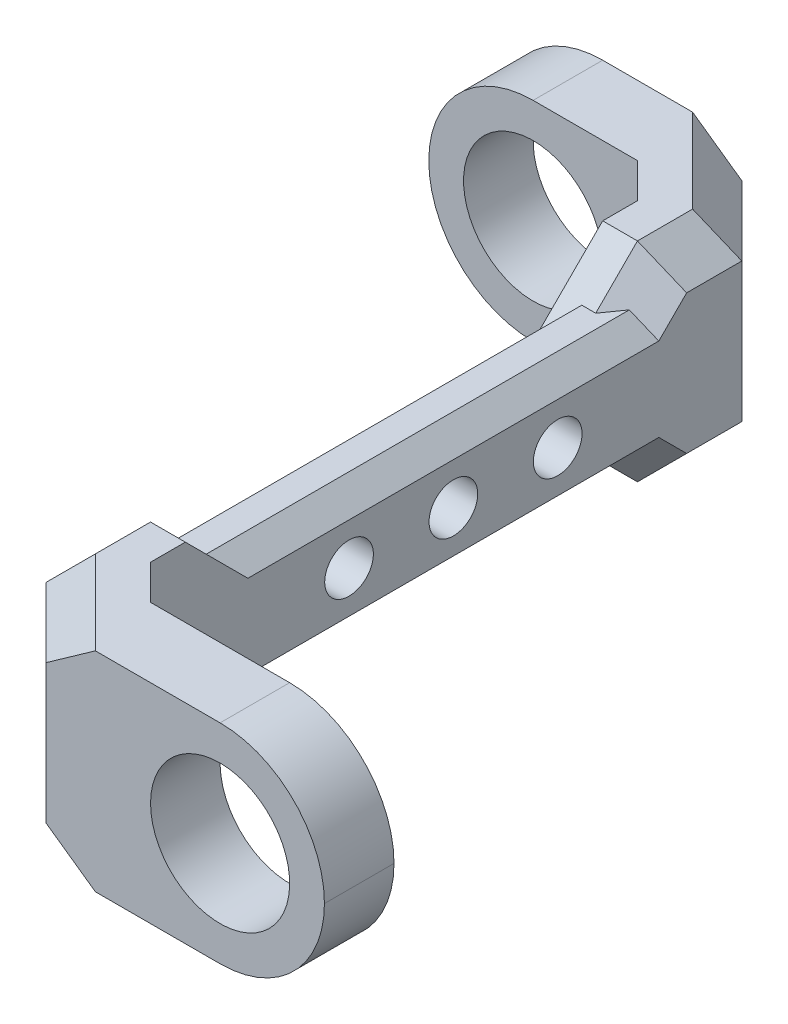
from build123d import *

# Parameters (mm, degrees)
SKETCH1_R           = 7.5
SKETCH1_R_2         = 5
BOSS_EXTRUDE1_DEPTH = 5
SKETCH2_W           = 5
SKETCH2_H           = 15
BOSS_EXTRUDE2_DEPTH = 50
SKETCH3_W           = 5
SKETCH3_H           = 15
BOSS_EXTRUDE3_DEPTH = 20
SKETCH4_R           = 5
CUT_EXTRUDE1_DEPTH  = 15
FILLET1_R           = 7.5
CHAMFER1_SIZE       = 5
CUT_EXTRUDE2_DEPTH  = 5
CHAMFER2_SIZE       = 1.5
CHAMFER3_SIZE       = 2.5
CHAMFER4_SIZE       = 2.5
SKETCH10_R          = 1.75
CUT_EXTRUDE4_DEPTH  = 10


with BuildPart() as part:
    # Sketch1 → Boss-Extrude1 (new body)
    # profile 1 of 2: a face of its own
    with BuildSketch(Plane.XY):
        Circle(SKETCH1_R)
        Circle(SKETCH1_R_2, mode=Mode.SUBTRACT)
    # profile 2 of 2: a face of its own
    with BuildSketch(Plane.XY):
        with BuildLine():
            Line((15, 7.5), (0, 7.5))
            ThreePointArc((0, 7.5), (5.303300859, 5.303300859), (7.5, 0))
            ThreePointArc((7.5, 0), (5.303300859, -5.303300859), (0, -7.5))
            Line((0, -7.5), (15, -7.5))
            Line((15, -7.5), (15, 7.5))
        make_face()
    extrude(amount=BOSS_EXTRUDE1_DEPTH)

    # Sketch2 → Boss-Extrude2 (add)
    with BuildSketch(Plane.XY.offset(5)):
        with Locations((12.5, 0)):
            Rectangle(SKETCH2_W, SKETCH2_H)
    extrude(amount=BOSS_EXTRUDE2_DEPTH)

    # Sketch3 → Boss-Extrude3 (add)
    with BuildSketch(Plane(origin=(15, 0, 0), x_dir=(0, 0, -1), z_dir=(1, 0, 0))):
        with Locations((-52.5, 0)):
            Rectangle(SKETCH3_W, SKETCH3_H)
    extrude(amount=BOSS_EXTRUDE3_DEPTH)

    # Sketch4 → Cut-Extrude1 (cut)
    with BuildSketch(Plane(origin=(0, 0, 50), x_dir=(-1, 0, 0), z_dir=(0, 0, -1))):
        with Locations(Location((-27.5, 0, 0), (0, 0, 90))):
            Circle(SKETCH4_R)
    extrude(amount=-CUT_EXTRUDE1_DEPTH, mode=Mode.SUBTRACT)

    # Fillet1
    fillet1_edges = [part.edges().sort_by_distance(p)[0] for p in [
        (35, -7.5, 52.5),
        (35, 7.5, 52.5),
    ]]
    fillet(fillet1_edges, radius=FILLET1_R - 0.0001)  # a hair under: the kernel refuses the full size

    # Chamfer1
    chamfer1_edges = [part.edges().sort_by_distance(p)[0] for p in [
        (10, 0, 55),
        (15, 0, 0),
    ]]
    chamfer(chamfer1_edges, length=CHAMFER1_SIZE)

    # Sketch5 → Cut-Extrude2 (cut)
    with BuildSketch(Plane.ZY.offset(-10)):
        Polygon((10, -7.5), (13, -4.5), (42, -4.5), (45, -7.5), align=None)
        Polygon((45, 7.5), (10, 7.5), (13, 4.5), (42, 4.5), align=None)
    extrude(amount=-CUT_EXTRUDE2_DEPTH, mode=Mode.SUBTRACT)

    # Chamfer2
    chamfer2_edges = [part.edges().sort_by_distance(p)[0] for p in [
        (15, -4.5, 27.5),
        (10, -4.5, 27.5),
        (15, 4.5, 27.5),
        (10, 4.5, 27.5),
    ]]
    chamfer(chamfer2_edges, length=CHAMFER2_SIZE)

    # Chamfer3
    chamfer3_edges = [part.edges().sort_by_distance(p)[0] for p in [
        (10, 7.5, 47.5),
        (12.5, 7.5, 52.5),
        (12.5, 7.5, 2.5),
        (10, -7.5, 47.5),
        (12.5, -7.5, 52.5),
        (12.5, -7.5, 2.5),
        (15, 7.5, 7.5),
        (15, -7.5, 7.5),
        (15, -5.25, 12.25),
        (10, -5.25, 42.75),
        (15, 5.25, 12.25),
        (10, 5.25, 42.75),
    ]]
    chamfer(chamfer3_edges, length=CHAMFER3_SIZE)

    # Chamfer4
    chamfer4_edges = [part.edges().sort_by_distance(p)[0] for p in [
        (10, 0, 5),
        (15, 0, 50),
    ]]
    chamfer(chamfer4_edges, length=CHAMFER4_SIZE)

    # Sketch10 → Cut-Extrude4 (cut)
    with BuildSketch(Plane(origin=(15, 0, 0), x_dir=(0, 0, -1), z_dir=(1, 0, 0))):
        with Locations((-25.732233047, 0)):
            Circle(SKETCH10_R)
        with Locations((-18.232233047, 0)):
            Circle(SKETCH10_R)
        with Locations(Location((-33.232233047, 0, 0), (0, 0, 90))):
            Circle(SKETCH10_R)
    extrude(amount=-CUT_EXTRUDE4_DEPTH, mode=Mode.SUBTRACT)


solid = part.part
